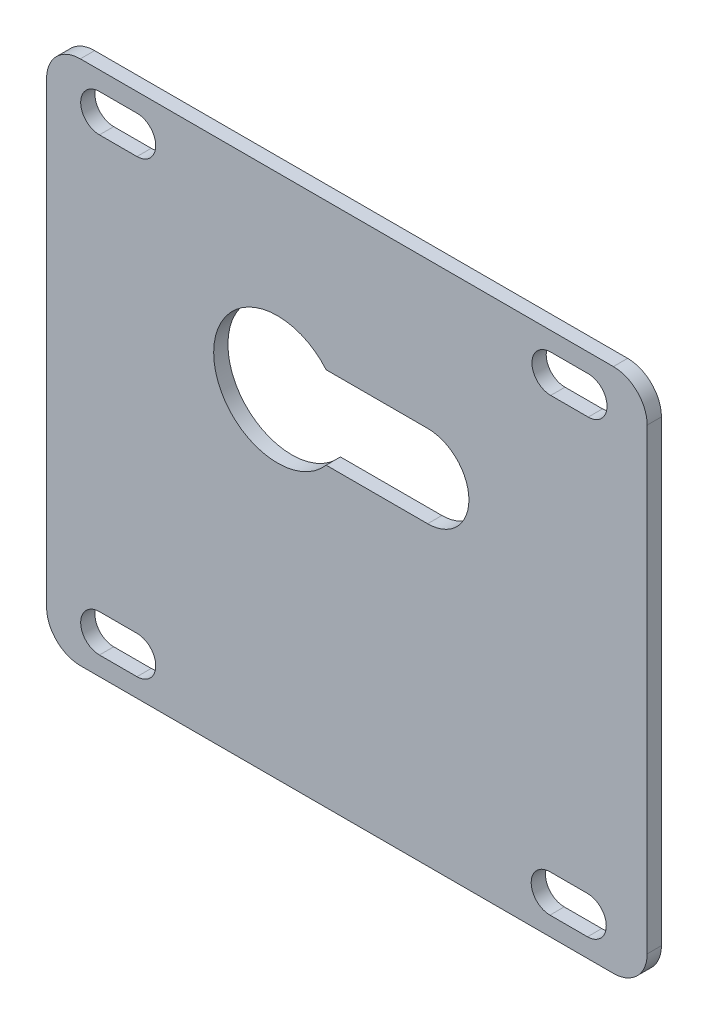
from build123d import *

# Parameters (mm, degrees)
BASE_FLANGE1_START = -1.9
BASE_FLANGE1_DEPTH = 1.9
CUT_EXTRUDE1_DEPTH = 10


# Read off the part's stored shape, not the designer's step: Base-Flange1
with BuildPart() as part:
    # Base-Flange1 outline → Base-Flange1 (new body)
    with BuildSketch(Plane.XY.offset(BASE_FLANGE1_START)):
        with BuildLine():
            Line((39.242670298, -40.5), (39.242670298, 20.5))
            ThreePointArc((39.242670298, 20.5), (37.924650813, 23.681980515), (34.742670298, 25))
            Line((34.742670298, 25), (-36.257329702, 25))
            ThreePointArc((-36.257329702, 25), (-39.439310218, 23.681980516), (-40.757329702, 20.5))
            Line((-40.757329702, 20.5), (-40.757329702, -40.5))
            ThreePointArc((-40.757329702, -40.5), (-39.439310218, -43.681980516), (-36.257329702, -45))
            Line((-36.257329702, -45), (34.742670298, -45))
            ThreePointArc((34.742670298, -45), (37.924650813, -43.681980515), (39.242670298, -40.5))
        make_face()
        with BuildLine():
            ThreePointArc((-33.7157381, -42.5), (-36.2157381, -40), (-33.7157381, -37.5))
            Line((-33.7157381, -37.5), (-28.7157381, -37.5))
            ThreePointArc((-28.7157381, -37.5), (-26.2157381, -40), (-28.7157381, -42.5))
            Line((-28.7157381, -42.5), (-33.7157381, -42.5))
        make_face(mode=Mode.SUBTRACT)
        with BuildLine():
            ThreePointArc((26.2942619, -42.5), (23.7942619, -40), (26.2942619, -37.5))
            Line((26.2942619, -37.5), (31.2942619, -37.5))
            ThreePointArc((31.2942619, -37.5), (33.7942619, -40), (31.2942619, -42.5))
            Line((31.2942619, -42.5), (26.2942619, -42.5))
        make_face(mode=Mode.SUBTRACT)
        with BuildLine():
            ThreePointArc((-33.7157381, 17.5), (-36.2157381, 20), (-33.7157381, 22.5))
            Line((-33.7157381, 22.5), (-28.7157381, 22.5))
            ThreePointArc((-28.7157381, 22.5), (-26.2157381, 20), (-28.7157381, 17.5))
            Line((-28.7157381, 17.5), (-33.7157381, 17.5))
        make_face(mode=Mode.SUBTRACT)
        with BuildLine():
            ThreePointArc((26.394136238, 17.5), (23.894136238, 20), (26.394136238, 22.5))
            Line((26.394136238, 22.5), (31.394136238, 22.5))
            ThreePointArc((31.394136238, 22.5), (33.894136238, 20), (31.394136238, 17.5))
            Line((31.394136238, 17.5), (26.394136238, 17.5))
        make_face(mode=Mode.SUBTRACT)
    extrude(amount=BASE_FLANGE1_DEPTH)

    # Sketch6 → Cut-Extrude1 (cut)
    with BuildSketch(Plane.XY):
        with BuildLine():
            Line((10, 5.5), (-3.519259302, 5.5))
            ThreePointArc((-3.519259302, 5.5), (-18.5, 0), (-3.519259302, -5.5))
            Line((-3.519259302, -5.5), (10, -5.5))
            ThreePointArc((10, -5.5), (15.5, 0), (10, 5.5))
        make_face()
    extrude(amount=-CUT_EXTRUDE1_DEPTH, mode=Mode.SUBTRACT)


solid = part.part
